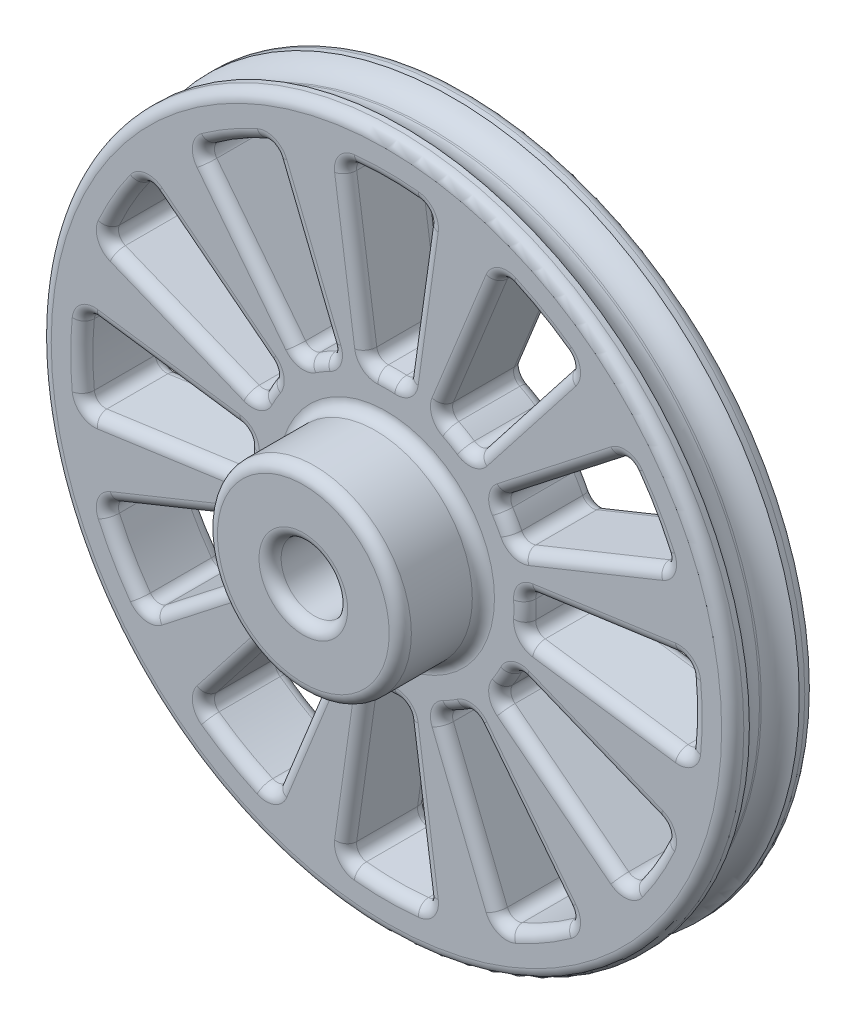
from build123d import *

# Parameters (mm, degrees)
SKETCH1_R           = 12.5
BOSS_EXTRUDE1_DEPTH = 0.6
SKETCH2_R           = 12
BOSS_EXTRUDE2_DEPTH = 1.8
SKETCH3_R           = 12.5
BOSS_EXTRUDE3_DEPTH = 0.6
SKETCH4_R           = 1.2
CUT_EXTRUDE1_DEPTH  = 10
FILLET1_R           = 1
CUT_EXTRUDE2_DEPTH  = 5
FILLET2_R           = 0.4
FILLET3_R           = 0.4
BOSS_EXTRUDE4_START = 3
SKETCH7_R           = 3.5
SKETCH7_R_2         = 1.2
BOSS_EXTRUDE4_DEPTH = 3
FILLET4_R           = 0.4
FILLET5_R           = 0.4
FILLET6_R           = 0.4
FILLET7_R           = 0.4


with BuildPart() as part:
    # Sketch1 → Boss-Extrude1 (new body)
    with BuildSketch(Plane.XY):
        Circle(SKETCH1_R)
    extrude(amount=BOSS_EXTRUDE1_DEPTH)

    # Sketch2 → Boss-Extrude2 (add)
    with BuildSketch(Plane.XY.offset(0.6)):
        Circle(SKETCH2_R)
    extrude(amount=BOSS_EXTRUDE2_DEPTH)

    # Sketch3 → Boss-Extrude3 (add)
    with BuildSketch(Plane.XY.offset(2.4)):
        Circle(SKETCH3_R)
    extrude(amount=BOSS_EXTRUDE3_DEPTH)

    # Sketch4 → Cut-Extrude1 (cut)
    with BuildSketch(Plane.XY.offset(2.9999999999999996)):
        Circle(SKETCH4_R)
    extrude(amount=-CUT_EXTRUDE1_DEPTH, mode=Mode.SUBTRACT)

    # Fillet1
    # the kernel refuses this fillet: 1 mm, written as the material it adds along each edge
    with BuildSketch(Plane(origin=(0, 0, 0.6), x_dir=(1, 0, 0), z_dir=(0, -1, 0))) as fillet1_piece_1:
        with BuildLine():
            CenterArc((13, 0.8660254037844873), FILLET1_R, 180, 60.00000000000142)
            Line((12.500000000000021, 3.653e-14), (12.490000000000022, -0.01732050807565244))
            ThreePointArc((12.490000000000022, -0.01732050807565244), (12.25000000000001, -0.02000000000000002), (12, -0.02000000000000002))
            Line((12, -0.02000000000000002), (11.98, 0))
            Line((11.98, 0), (11.98, 0.8660254037844873))
            Line((11.98, 0.8660254037844873), (12, 0.8660254037844873))
        make_face()
    revolve(axis=Axis((0, 0, 0.6), (0, 0, 1)))
    with BuildSketch(Plane(origin=(0, 0, 2.4), x_dir=(1, 0, 0), z_dir=(0, -1, 0))) as fillet1_piece_2:
        with BuildLine():
            CenterArc((13, -0.8660254037844872), FILLET1_R, 119.9999999999986, 60.00000000000141)
            Line((12, -0.8660254037844872), (11.98, -0.8660254037844872))
            Line((11.98, -0.8660254037844872), (11.98, 0))
            Line((11.98, 0), (12, 0.02000000000000002))
            ThreePointArc((12, 0.02000000000000002), (12.25000000000001, 0.02000000000000002), (12.490000000000022, 0.01732050807565244))
            Line((12.490000000000022, 0.01732050807565244), (12.500000000000021, -3.642e-14))
        make_face()
    revolve(axis=Axis((0, 0, 2.4), (0, 0, 1)))

    # Sketch6 → Cut-Extrude2 (cut)
    with BuildSketch(Plane.XY.offset(2.9999999999999996)):
        with BuildLine():
            ThreePointArc((-4.951340343707845, -0.695865504800385), (-4.987820251299121, -0.34878236872065527), (-5.000000000000002, 6.1e-16))
            Line((-5.000000000000002, 0), (-11.000000000000002, 0))
            ThreePointArc((-11.000000000000002, 1.35e-15), (-10.973204552858066, -0.7673212111854268), (-10.892948756157262, -1.5309041105608177))
            Line((-10.892948756157272, -1.530904110560744), (-4.951340343707851, -0.6958655048003382))
        make_face()
        with BuildLine():
            Line((-11.000000000000002, 0), (-5.000000000000002, 0))
            ThreePointArc((-5.000000000000002, 6.1e-16), (-4.987820251299121, 0.3487823687206543), (-4.951340343707845, 0.6958655048003818))
            Line((-4.951340343707853, 0.6958655048003368), (-10.892948756157272, 1.5309041105607406))
            ThreePointArc((-10.892948756157262, 1.53090411056082), (-10.973204552858066, 0.7673212111854296), (-11.000000000000002, 1.35e-15))
        make_face()
        with BuildLine():
            ThreePointArc((-4.635919272833887, 1.8730329670796872), (-4.330127018922144, 2.5000000000000893), (-3.94005376803357, 3.078307376628345))
            Line((-3.9400537680335677, 3.078307376628348), (-8.668118289673847, 6.772276228582364))
            ThreePointArc((-8.668118289673703, 6.772276228582547), (-9.526279441628683, 5.5000000000002505), (-10.199022400234595, 4.120672527575203))
            Line((-10.19902240023464, 4.120672527575111), (-4.635919272833927, 1.8730329670795958))
        make_face()
        with BuildLine():
            ThreePointArc((-3.078307376628226, 3.940053768033663), (-2.4999999999999614, 4.330127018922218), (-1.8730329670795558, 4.635919272833941))
            Line((-1.8730329670794639, 4.635919272833979), (-4.120672527574819, 10.19902240023475))
            ThreePointArc((-4.120672527574915, 10.19902240023471), (-5.499999999999961, 9.52627944162885), (-6.772276228582269, 8.668118289673922))
            Line((-6.772276228582104, 8.668118289674057), (-3.0783073766282287, 3.9400537680336614))
        make_face()
        with BuildLine():
            ThreePointArc((-0.6958655048002743, 4.9513403437078605), (1.0689e-13, 5.000000000000002), (0.695865504800487, 4.951340343707831))
            Line((0.6958655048004387, 4.9513403437078365), (1.5309041105609653, 10.89294875615724))
            ThreePointArc((1.5309041105610446, 10.89294875615723), (2.3515e-13, 11.000000000000002), (-1.5309041105605765, 10.892948756157296))
            Line((-1.530904110560496, 10.892948756157306), (-0.6958655048002256, 4.951340343707868))
        make_face()
        with BuildLine():
            ThreePointArc((1.8730329670797417, 4.635919272833865), (2.5000000000001212, 4.330127018922125), (3.0783073766283593, 3.940053768033559))
            Line((3.078307376628362, 3.940053768033557), (6.772276228582396, 8.668118289673826))
            ThreePointArc((6.772276228582578, 8.66811828967368), (5.500000000000321, 9.526279441628642), (4.120672527575322, 10.199022400234545))
            Line((4.120672527575226, 10.199022400234584), (1.8730329670796486, 4.635919272833903))
        make_face()
        with BuildLine():
            ThreePointArc((3.9400537680336507, 3.078307376628242), (4.330127018922196, 2.499999999999998), (4.635919272833917, 1.873032967079614))
            Line((4.635919272833953, 1.8730329670795218), (10.199022400234695, 4.120672527574947))
            ThreePointArc((10.199022400234659, 4.120672527575042), (9.526279441628803, 5.50000000000004), (8.668118289673892, 6.772276228582307))
            Line((8.668118289674029, 6.772276228582137), (3.9400537680336494, 3.0783073766282443))
        make_face()
        with BuildLine():
            ThreePointArc((5.000000000000002, -1.22e-15), (4.987820251299123, -0.34878236872061946), (4.951340343707855, -0.6958655048003121))
            Line((4.951340343707856, -0.6958655048003122), (10.892948756157283, -1.5309041105606866))
            ThreePointArc((10.89294875615726, -1.5309041105608312), (10.973204552858064, -0.767321211185431), (11.000000000000002, -2.69e-15))
            ThreePointArc((11.000000000000002, 0), (10.973204552858064, 0.7673212111854355), (10.89294875615726, 1.5309041105608334))
            Line((10.892948756157278, 1.530904110560695), (4.951340343707853, 0.6958655048003158))
            ThreePointArc((4.951340343707854, 0.6958655048003173), (4.987820251299123, 0.3487823687206215), (5.000000000000002, 0))
        make_face()
        with BuildLine():
            ThreePointArc((4.635919272833917, -1.873032967079616), (4.3301270189222, -2.4999999999999916), (3.9400537680336583, -3.078307376628232))
            Line((3.9400537680336543, -3.078307376628237), (8.668118289674036, -6.772276228582119))
            ThreePointArc((8.66811828967389, -6.772276228582309), (9.5262794416288, -5.500000000000049), (10.199022400234659, -4.120672527575046))
            Line((10.199022400234696, -4.120672527574941), (4.635919272833954, -1.873032967079519))
        make_face()
        with BuildLine():
            ThreePointArc((3.078307376628356, -3.940053768033561), (2.5000000000001243, -4.3301270189221235), (1.8730329670797496, -4.6359192728338625))
            Line((1.8730329670796595, -4.635919272833899), (4.12067252757525, -10.199022400234576))
            ThreePointArc((4.1206725275753495, -10.199022400234535), (5.500000000000332, -9.526279441628635), (6.772276228582569, -8.668118289673687))
            Line((6.772276228582397, -8.66811828967382), (3.078307376628363, -3.940053768033556))
        make_face()
        with BuildLine():
            ThreePointArc((0.6958655048004815, -4.951340343707832), (1.0566e-13, -5.000000000000002), (-0.6958655048002678, -4.951340343707862))
            Line((-0.6958655048002166, -4.9513403437078685), (-1.5309041105604766, -10.892948756157312))
            ThreePointArc((-1.5309041105605599, -10.892948756157297), (2.3246e-13, -11.000000000000002), (1.53090411056103, -10.892948756157232))
            Line((1.5309041105609575, -10.892948756157244), (0.6958655048004353, -4.951340343707838))
        make_face()
        with BuildLine():
            ThreePointArc((-1.8730329670796237, -4.635919272833913), (-2.500000000000007, -4.330127018922191), (-3.0783073766282496, -3.940053768033645))
            Line((-3.0783073766282563, -3.9400537680336396), (-6.772276228582164, -8.668118289674007))
            ThreePointArc((-6.7722762285823475, -8.66811828967386), (-5.500000000000073, -9.526279441628784), (-4.120672527575063, -10.199022400234652))
            Line((-4.1206725275749605, -10.199022400234695), (-1.8730329670795278, -4.635919272833953))
        make_face()
        with BuildLine():
            ThreePointArc((-3.9400537680335797, -3.0783073766283326), (-4.330127018922142, -2.500000000000092), (-4.6359192728338785, -1.873032967079709))
            Line((-4.635919272833916, -1.873032967079617), (-10.199022400234613, -4.120672527575157))
            ThreePointArc((-10.199022400234577, -4.120672527575246), (-9.526279441628684, -5.500000000000248), (-8.668118289673735, -6.772276228582507))
            Line((-8.66811828967387, -6.772276228582339), (-3.9400537680335774, -3.0783073766283358))
        make_face()
    extrude(amount=-CUT_EXTRUDE2_DEPTH, mode=Mode.SUBTRACT)

    # Fillet2
    fillet2_edges = [part.edges().sort_by_distance(p)[0] for p in [
        (-12.5, 1.53e-15, 0),
        (-12.5, 1.53e-15, 3),
    ]]
    fillet(fillet2_edges, radius=FILLET2_R)

    # Fillet3
    fillet3_edges = [part.edges().sort_by_distance(p)[0] for p in [
        (1.113384807680702, 7.922144549932538, 2.9999999999999996),
        (2.3648e-13, 11, 2.9999999999999996),
        (7.417470836534324, 2.996852747327235, 0),
        (10.199022400234675, 4.120672527574994, 1.4999999999999998),
        (4.635919272833935, 1.873032967079568, 1.4999999999999998),
        (4.330127018922196, 2.4999999999999982, 2.9999999999999996),
        (3.94005376803365, 3.078307376628243, 1.4999999999999998),
        (6.304086028853839, 4.925291802605191, 2.9999999999999996),
        (9.526279441628802, 5.500000000000039, 0),
        (8.66811828967396, 6.772276228582221, 1.4999999999999998),
        (4.330127018922197, 2.4999999999999973, 0),
        (6.304086028853839, 4.925291802605191, -2.2e-16),
        (7.417470836534324, 2.9968527473272344, 2.9999999999999996),
        (9.526279441628802, 5.500000000000039, 2.9999999999999996),
        (4.925291802605379, 6.304086028853692, 0),
        (6.772276228582488, 8.668118289673753, 1.4999999999999998),
        (3.078307376628361, 3.9400537680335583, 1.4999999999999998),
        (2.500000000000122, 4.330127018922124, 2.9999999999999996),
        (1.8730329670796952, 4.635919272833885, 1.4999999999999998),
        (2.9968527473274373, 7.417470836534244, 2.9999999999999996),
        (5.500000000000323, 9.526279441628642, 0),
        (4.120672527575275, 10.199022400234565, 1.4999999999999998),
        (2.5000000000001243, 4.3301270189221235, 0),
        (2.9968527473274373, 7.417470836534244, 0),
        (4.925291802605379, 6.304086028853691, 2.9999999999999996),
        (5.5000000000003215, 9.526279441628645, 2.9999999999999996),
        (7.922144549932571, -1.1133848076804997, -2.2e-16),
        (10.892948756157274, -1.5309041105607593, 1.4999999999999998),
        (4.951340343707855, -0.6958655048003121, 1.4999999999999998),
        (5.000000000000001, 2.6e-15, 2.9999999999999996),
        (4.951340343707854, 0.6958655048003166, 1.4999999999999998),
        (7.922144549932566, 1.1133848076805055, 2.9999999999999996),
        (11.000000000000007, 9.912e-14, 0),
        (10.892948756157267, 1.5309041105607641, 1.4999999999999998),
        (5.000000000000002, -1.825e-14, 0),
        (7.922144549932565, 1.1133848076805053, 0),
        (7.92214454993257, -1.1133848076804993, 2.9999999999999996),
        (11, 2.47e-15, 2.9999999999999996),
        (2.996852747327455, -7.417470836534237, 0),
        (4.120672527575301, -10.199022400234556, 1.4999999999999998),
        (1.8730329670797041, -4.63591927283388, 1.4999999999999998),
        (2.5000000000001243, -4.3301270189221235, 2.9999999999999996),
        (3.0783073766283593, -3.9400537680335583, 1.4999999999999998),
        (4.92529180260538, -6.304086028853688, 2.9999999999999996),
        (5.500000000000327, -9.526279441628638, 0),
        (6.7722762285824825, -8.668118289673755, 1.4999999999999998),
        (2.5000000000001235, -4.3301270189221235, 0),
        (4.92529180260538, -6.304086028853688, 0),
        (2.9968527473274547, -7.417470836534237, 2.9999999999999996),
        (5.500000000000327, -9.526279441628638, 2.9999999999999996),
        (6.3040860288538445, -4.925291802605178, 0),
        (8.668118289673963, -6.772276228582214, 1.4999999999999998),
        (3.9400537680336565, -3.078307376628234, 1.4999999999999998),
        (4.330127018922199, -2.499999999999993, 2.9999999999999996),
        (4.635919272833935, -1.8730329670795676, 1.4999999999999998),
        (7.417470836534325, -2.99685274732723, 2.9999999999999996),
        (9.5262794416288, -5.500000000000043, 0),
        (10.199022400234677, -4.1206725275749925, 1.4999999999999998),
        (4.330127018922199, -2.499999999999994, 0),
        (7.417470836534327, -2.9968527473272304, 0),
        (6.304086028853845, -4.925291802605178, 2.9999999999999996),
        (9.5262794416288, -5.500000000000043, 2.9999999999999996),
        (-1.1133848076803465, -7.9221445499325895, 0),
        (-1.5309041105605183, -10.892948756157306, 1.4999999999999998),
        (-0.6958655048002422, -4.951340343707866, 1.4999999999999998),
        (1.0802e-13, -5.000000000000001, 2.9999999999999996),
        (0.6958655048004585, -4.951340343707836, 1.4999999999999998),
        (1.1133848076806965, -7.922144549932542, 2.9999999999999996),
        (2.3753e-13, -11.000000000000002, 0),
        (1.5309041105609942, -10.892948756157239, 1.4999999999999998),
        (1.058e-13, -5.000000000000002, 0),
        (1.1133848076806963, -7.922144549932541, -2.2e-16),
        (-1.1133848076803465, -7.9221445499325895, 2.9999999999999996),
        (2.3753e-13, -11.000000000000002, 2.9999999999999996),
        (-7.417470836534266, -2.9968527473273876, 0),
        (-10.199022400234597, -4.120672527575202, 1.4999999999999998),
        (-4.635919272833897, -1.8730329670796633, 1.4999999999999998),
        (-4.330127018922141, -2.5000000000000915, 2.9999999999999996),
        (-3.9400537680335788, -3.0783073766283344, 1.4999999999999998),
        (-6.304086028853724, -4.925291802605337, 2.9999999999999996),
        (-9.526279441628686, -5.500000000000246, 0),
        (-8.668118289673803, -6.772276228582424, 1.4999999999999998),
        (-4.330127018922143, -2.5000000000000906, 0),
        (-6.304086028853724, -4.925291802605337, 0),
        (-7.417470836534264, -2.996852747327387, 2.9999999999999996),
        (-9.526279441628686, -5.500000000000246, 2.9999999999999996),
        (-4.9252918026052095, -6.304086028853823, 0),
        (-6.772276228582255, -8.668118289673933, 1.4999999999999998),
        (-3.0783073766282527, -3.9400537680336427, 1.4999999999999998),
        (-2.500000000000006, -4.330127018922191, 2.9999999999999996),
        (-1.8730329670795758, -4.635919272833933, 1.4999999999999998),
        (-2.996852747327244, -7.417470836534324, 2.9999999999999996),
        (-5.500000000000071, -9.526279441628782, 0),
        (-4.120672527575012, -10.199022400234671, 1.4999999999999998),
        (-2.500000000000007, -4.330127018922191, 0),
        (-2.9968527473272433, -7.4174708365343225, 0),
        (-4.92529180260521, -6.304086028853824, 2.9999999999999996),
        (-5.500000000000071, -9.526279441628782, 2.9999999999999996),
        (-4.95134034370785, 0.6958655048003594, 1.4999999999999998),
        (-5.0000000000000036, -9.2e-16, 2.9999999999999996),
        (-4.951340343707848, -0.6958655048003617, 1.4999999999999998),
        (-7.922144549932561, -1.113384807680541, 2.9999999999999996),
        (-11.000000000000004, 5.289e-14, 0),
        (-10.892948756157267, -1.530904110560781, 1.4999999999999998),
        (-7.922144549932563, 1.1133848076805386, 0),
        (-10.892948756157267, 1.5309041105607804, 1.4999999999999998),
        (-5.000000000000002, -8.6e-15, 0),
        (-7.922144549932562, -1.113384807680541, 0),
        (-7.922144549932563, 1.1133848076805388, 2.9999999999999996),
        (-11.000000000000005, -8e-17, 2.9999999999999996),
        (-2.996852747327142, 7.417470836534365, 0),
        (-4.120672527574866, 10.19902240023473, 1.4999999999999998),
        (-1.8730329670795096, 4.635919272833959, 1.4999999999999998),
        (-2.499999999999962, 4.330127018922217, 2.9999999999999996),
        (-3.078307376628227, 3.9400537680336623, 1.4999999999999998),
        (-4.925291802605166, 6.30408602885386, 2.9999999999999996),
        (-5.499999999999961, 9.526279441628848, 0),
        (-6.772276228582187, 8.66811828967399, 1.4999999999999998),
        (-2.499999999999961, 4.330127018922218, 0),
        (-4.925291802605166, 6.304086028853859, 0),
        (-2.9968527473271416, 7.417470836534364, 2.9999999999999996),
        (-5.499999999999961, 9.526279441628848, 2.9999999999999996),
        (-6.304086028853708, 4.925291802605356, 0),
        (-8.668118289673775, 6.772276228582456, 1.4999999999999998),
        (-3.9400537680335685, 3.078307376628347, 1.4999999999999998),
        (-4.330127018922144, 2.500000000000089, 2.9999999999999996),
        (-4.635919272833908, 1.8730329670796415, 1.4999999999999998),
        (-7.417470836534283, 2.9968527473273534, 2.9999999999999996),
        (-9.526279441628684, 5.500000000000247, 0),
        (-10.199022400234618, 4.120672527575158, 1.4999999999999998),
        (-4.330127018922143, 2.5000000000000906, 0),
        (-7.417470836534283, 2.996852747327353, 0),
        (-6.304086028853707, 4.925291802605356, 2.9999999999999996),
        (-9.526279441628681, 5.500000000000247, 2.9999999999999996),
        (1.113384807680702, 7.922144549932539, -2.2e-16),
        (1.5309041105610048, 10.892948756157235, 1.4999999999999998),
        (0.695865504800463, 4.951340343707834, 1.4999999999999998),
        (1.0755e-13, 5.000000000000002, 2.9999999999999996),
        (-0.69586550480025, 4.951340343707864, 1.4999999999999998),
        (-1.1133848076803607, 7.922144549932587, 2.9999999999999996),
        (2.3692e-13, 11, 0),
        (-1.5309041105605359, 10.8929487561573, 1.4999999999999998),
        (1.0889e-13, 5.000000000000002, 0),
        (-1.1133848076803607, 7.922144549932587, -2.2e-16),
    ]]
    fillet(fillet3_edges, radius=FILLET3_R)

    # Sketch7 → Boss-Extrude4 (add)
    with BuildSketch(Plane.XY.offset(2.9999999999999996).offset(BOSS_EXTRUDE4_START)):
        Circle(SKETCH7_R)
        Circle(SKETCH7_R_2, mode=Mode.SUBTRACT)
    extrude(amount=-BOSS_EXTRUDE4_DEPTH)

    # Fillet4
    fillet4_edges = [part.edges().sort_by_distance(p)[0] for p in [
        (-3.4999999999999964, 4.3e-16, 6),
    ]]
    fillet(fillet4_edges, radius=FILLET4_R)

    # Fillet5
    fillet5_edges = [part.edges().sort_by_distance(p)[0] for p in [
        (-1.2, 1.5e-16, 6),
    ]]
    fillet(fillet5_edges, radius=FILLET5_R)

    # Fillet6
    fillet6_edges = [part.edges().sort_by_distance(p)[0] for p in [
        (-3.4999999999999964, 4.3e-16, 2.9999999999999996),
    ]]
    fillet(fillet6_edges, radius=FILLET6_R)

    # Fillet7
    fillet7_edges = [part.edges().sort_by_distance(p)[0] for p in [
        (-1.2, 1.5e-16, 0),
    ]]
    fillet(fillet7_edges, radius=FILLET7_R)


solid = part.part
